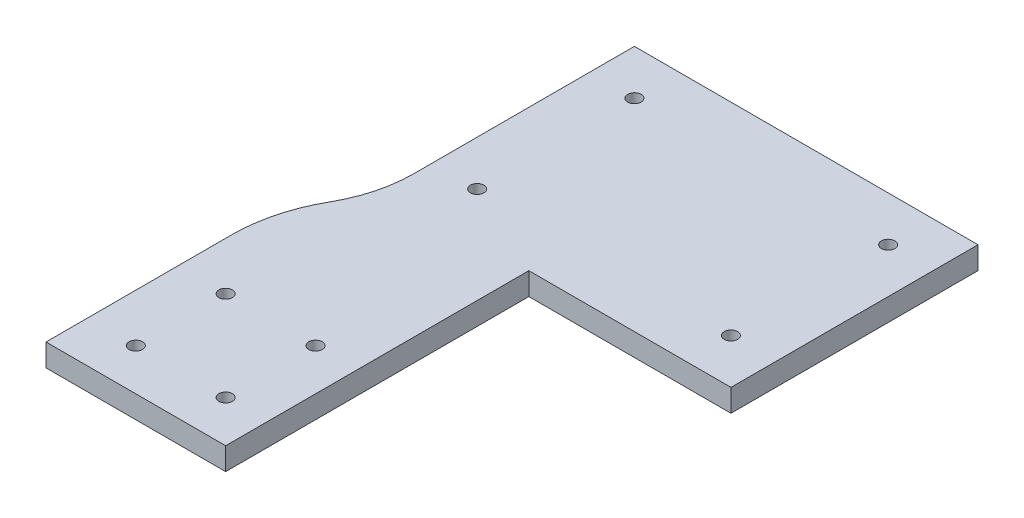
from build123d import *

# Parameters (mm, degrees)
SKETCH1_R           = 3
BOSS_EXTRUDE1_DEPTH = 10
FILLET2_R           = 60
FILLET3_R           = 70


with BuildPart() as part:
    # Sketch1 → Boss-Extrude1 (new body)
    with BuildSketch(Plane(origin=(0, 0, 0), x_dir=(1, 0, 0), z_dir=(0, 1, 0))):
        Polygon((165, -120), (85, -120), (85, -15), (102, -15), (102, 125), (255, 125), (255, 15), (165, 15), align=None)
        with Locations(Location((146.4, -101.4, 0), (0, 0, 270))):
            Circle(SKETCH1_R, mode=Mode.SUBTRACT)
        with Locations(Location((106.4, -101.4, 0), (0, 0, 270))):
            Circle(SKETCH1_R, mode=Mode.SUBTRACT)
        with Locations(Location((146.4, -61.4, 0), (0, 0, 270))):
            Circle(SKETCH1_R, mode=Mode.SUBTRACT)
        with Locations(Location((106.4, -61.4, 0), (0, 0, 270))):
            Circle(SKETCH1_R, mode=Mode.SUBTRACT)
        with Locations(Location((122, 35, 0), (0, 0, 270))):
            Circle(SKETCH1_R, mode=Mode.SUBTRACT)
        with Locations(Location((235, 35, 0), (0, 0, 270))):
            Circle(SKETCH1_R, mode=Mode.SUBTRACT)
        with Locations(Location((235, 105, 0), (0, 0, 270))):
            Circle(SKETCH1_R, mode=Mode.SUBTRACT)
        with Locations(Location((122, 105, 0), (0, 0, 270))):
            Circle(SKETCH1_R, mode=Mode.SUBTRACT)
    extrude(amount=BOSS_EXTRUDE1_DEPTH)

    # Fillet2
    # the kernel refuses this fillet: 60 mm, written as the material it adds along each edge
    with BuildSketch(Plane(origin=(102, 0, 15), x_dir=(-1, 0, 0), z_dir=(0, 1, 0))) as fillet2_piece_1:
        with BuildLine():
            CenterArc((60, -41.844951906), FILLET2_R, 135.779955572, 44.220044428)
            Line((0, -41.844951906), (-1.2, -41.844951906))
            Line((-1.2, -41.844951906), (-1.2, 0))
            Line((-1.2, 0), (0, 1.2))
            ThreePointArc((0, 1.2), (8.5, 1.2), (16.14, 0.836899038))
            Line((16.14, 0.836899038), (17, 0))
        make_face()
    extrude(amount=10)

    # Fillet3
    fillet3_edges = [part.edges().sort_by_distance(p)[0] for p in [
        (85, 5, 15),
    ]]
    fillet(fillet3_edges, radius=FILLET3_R)


solid = part.part
